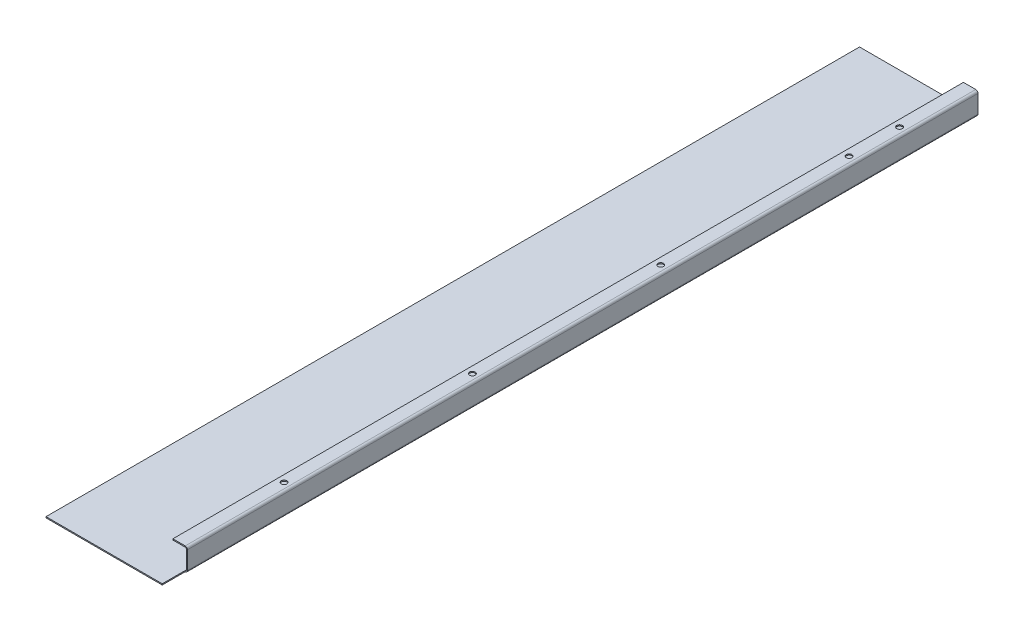
from build123d import *

# Parameters (mm, degrees)
SKETCH1_W                    = 105.7
SKETCH1_H                    = 725.7
BASE_FLANGE1_DEPTH           = 1
EDGE_FLANGE1_STRIP_W         = 6
EDGE_FLANGE1_STRIP_H         = 1
EDGE_FLANGE1_STRIP_CUT_DEPTH = 725.7
EDGE_FLANGE1_DEPTH           = 725.7
EDGE_FLANGE2_STRIP_W         = 6
EDGE_FLANGE2_STRIP_H         = 1
EDGE_FLANGE2_STRIP_CUT_DEPTH = 725.7
EDGE_FLANGE2_DEPTH           = 725.7
SKETCH19_R                   = 2.5
CUT_EXTRUDE2_DEPTH           = 10
CUT_EXTRUDE3_START           = -20.5
CUT_EXTRUDE3_DEPTH           = 20.5


# Read off the part's stored shape, not the designer's step: Cut-Extrude3
# Sheet-metal steps are written as plain solids
with BuildPart() as part:
    # Sketch1 → Base-Flange1 (new body)
    with BuildSketch(Plane(origin=(0, 0, 0), x_dir=(1, 0, 0), z_dir=(0, 1, 0))):
        with Locations((52.85, 362.85)):
            Rectangle(SKETCH1_W, SKETCH1_H)
    extrude(amount=-BASE_FLANGE1_DEPTH)

    # Edge-Flange1 strip (across the edge) → Edge-Flange1 strip cut (cut)
    with BuildSketch(Plane(origin=(105.7, 0, 0), x_dir=(-1, 0, 0), z_dir=(0, 0, -1))):
        with Locations((-1, -0.5)):
            Rectangle(EDGE_FLANGE1_STRIP_W, EDGE_FLANGE1_STRIP_H)
    extrude(amount=EDGE_FLANGE1_STRIP_CUT_DEPTH, mode=Mode.SUBTRACT)

    # Edge-Flange1 section (across the edge) → Edge-Flange1 (add)
    with BuildSketch(Plane(origin=(105.7, 0, 0), x_dir=(-1, 0, 0), z_dir=(0, 0, -1))):
        with BuildLine():
            Line((0, 1), (0, 19))
            Line((0, 19), (1, 19))
            Line((1, 19), (1, 1))
            ThreePointArc((1, 1), (1.292893219, 0.292893219), (2, 0))
            Line((2, 0), (2, -1))
            ThreePointArc((2, -1), (0.585786438, -0.414213562), (0, 1))
        make_face()
    extrude(amount=EDGE_FLANGE1_DEPTH)

    # Edge-Flange2 strip (across the edge) → Edge-Flange2 strip cut (cut)
    with BuildSketch(Plane(origin=(104.7, 19, 0), x_dir=(0, -1, 0), z_dir=(0, 0, -1))):
        with Locations((-1, -0.5)):
            Rectangle(EDGE_FLANGE2_STRIP_W, EDGE_FLANGE2_STRIP_H)
    extrude(amount=EDGE_FLANGE2_STRIP_CUT_DEPTH, mode=Mode.SUBTRACT)

    # Edge-Flange2 section (across the edge) → Edge-Flange2 (add)
    with BuildSketch(Plane(origin=(104.7, 19, 0), x_dir=(0, -1, 0), z_dir=(0, 0, -1))):
        with BuildLine():
            Line((0, 1), (0, 12))
            Line((0, 12), (1, 12))
            Line((1, 12), (1, 1))
            ThreePointArc((1, 1), (1.292893219, 0.292893219), (2, 0))
            Line((2, 0), (2, -1))
            ThreePointArc((2, -1), (0.585786438, -0.414213562), (0, 1))
        make_face()
    extrude(amount=EDGE_FLANGE2_DEPTH)

    # Sketch19 → Cut-Extrude2 (cut)
    with BuildSketch(Plane(origin=(0, 19, 0), x_dir=(1, 0, 0), z_dir=(0, 1, 0))):
        with Locations(Location((98.7, 662.7, 0), (0, 0, 180))):
            Circle(SKETCH19_R)
        with Locations(Location((98.7, 617.7, 0), (0, 0, 180))):
            Circle(SKETCH19_R)
        with Locations(Location((98.7, 449.7, 0), (0, 0, 180))):
            Circle(SKETCH19_R)
        with Locations(Location((98.7, 281.7, 0), (0, 0, 180))):
            Circle(SKETCH19_R)
        with Locations(Location((98.7, 113.7, 0), (0, 0, 180))):
            Circle(SKETCH19_R)
        with Locations((98.7, -54.3)):
            Circle(SKETCH19_R)
    extrude(amount=-CUT_EXTRUDE2_DEPTH, mode=Mode.SUBTRACT)

    # Cut-Extrude3 outline → Cut-Extrude3 (cut)
    with BuildSketch(Plane.XY.offset(CUT_EXTRUDE3_START)):
        with BuildLine():
            ThreePointArc((104.7, 1), (104.407106781, 0.292893219), (103.7, 0))
            Line((103.7, 0), (103.7, -1))
            ThreePointArc((103.7, -1), (105.114213562, -0.414213562), (105.7, 1))
            Line((105.7, 1), (105.7, 17))
            ThreePointArc((105.7, 17), (105.114213562, 18.414213562), (103.7, 19))
            Line((103.7, 19), (92.7, 19))
            Line((92.7, 19), (92.7, 18))
            Line((92.7, 18), (103.7, 18))
            ThreePointArc((103.7, 18), (104.407106781, 17.707106781), (104.7, 17))
            Line((104.7, 17), (104.7, 1))
        make_face()
    extrude(amount=CUT_EXTRUDE3_DEPTH, mode=Mode.SUBTRACT)


solid = part.part
